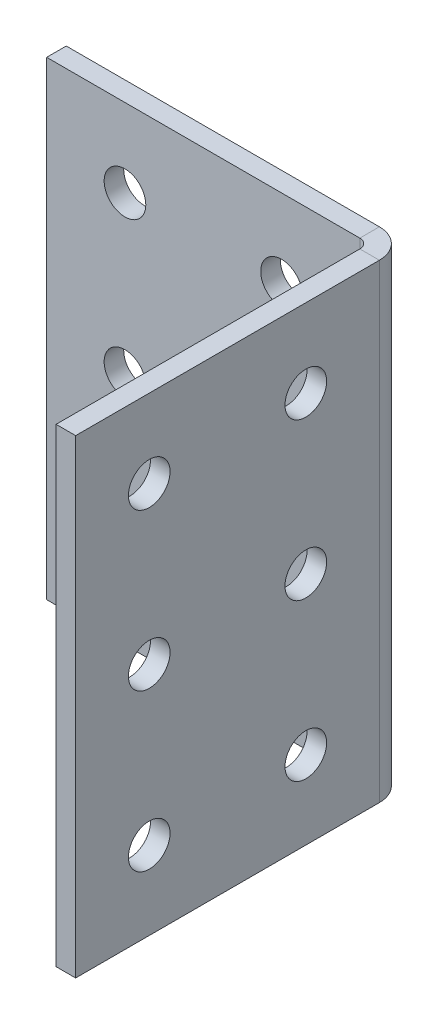
from build123d import *

# Parameters (mm, degrees)
SKETCH1_W               = 50.8
SKETCH1_H               = 76.2
BASE_FLANGE1_DEPTH      = 3.175
EDGE_FLANGE1_DEPTH      = 76.2
F_1_4_CLEARANCE_HOLE1_D = 6.7564
F_1_4_CLEARANCE_HOLE2_D = 6.7564


# Sheet-metal steps are written as plain solids
with BuildPart() as part:
    # Sketch1 → Base-Flange1 (new body)
    with BuildSketch(Plane.XY):
        with Locations((25.4, 38.1)):
            Rectangle(SKETCH1_W, SKETCH1_H)
    extrude(amount=-BASE_FLANGE1_DEPTH)

    # Edge-Flange1 section (across the edge) → Edge-Flange1 (add)
    with BuildSketch(Plane(origin=(52.324, 0, 0), x_dir=(-1, 0, 0), z_dir=(0, 1, 0))):
        with BuildLine():
            Line((-3.175, 1.524), (-3.175, 50.8))
            Line((-3.175, 50.8), (0, 50.8))
            Line((0, 50.8), (0, 1.524))
            ThreePointArc((0, 1.524), (0.446369265, 0.446369265), (1.524, 0))
            Line((1.524, 0), (1.524, -3.175))
            ThreePointArc((1.524, -3.175), (-1.798694765, -1.798694765), (-3.175, 1.524))
        make_face()
    extrude(amount=EDGE_FLANGE1_DEPTH)

    # 1/4 Clearance Hole1 (through all)
    with Locations(Plane.XY):
        with Locations((38.1, 63.5), (12.7, 63.5), (12.7, 38.1), (38.1, 38.1), (12.7, 12.7), (38.1, 12.7)):
            Hole(F_1_4_CLEARANCE_HOLE1_D / 2)

    # 1/4 Clearance Hole2 (through all)
    with Locations(Plane.ZY.offset(-52.324)):
        with Locations((13.462, 63.5), (38.862, 63.5), (13.462, 38.1), (38.862, 38.1), (13.462, 12.7), (38.862, 12.7)):
            Hole(F_1_4_CLEARANCE_HOLE2_D / 2)


solid = part.part
